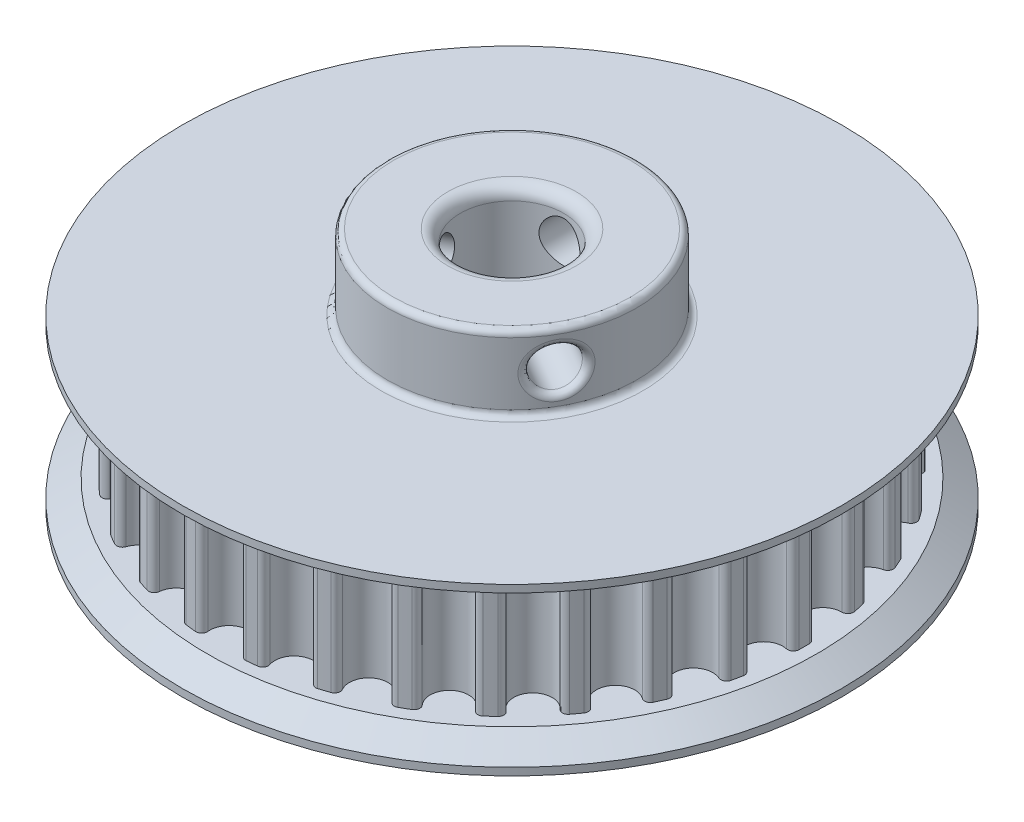
from build123d import *
from OCP.BRepFilletAPI import BRepFilletAPI_MakeChamfer

# Parameters (mm, degrees)
BOSS_EXTRU_1_DEPTH           = 9.3
R_P_TITION_CIRCULAIRE1_COUNT = 30
ESQUISSE2_R                  = 26.4290252
BOSS_EXTRU_2_DEPTH           = 2
CHANFREIN1_SIZE              = 2
CHANFREIN1_SIZE2             = 1.400415076
ESQUISSE4_R                  = 10
BOSS_EXTRU_3_DEPTH           = 6
ESQUISSE5_R                  = 1.65
ENL_V_MAT_EXTRU_2_DEPTH      = 42.185880421
R_P_TITION_CIRCULAIRE2_COUNT = 3
ENL_V_MAT_EXTRU_1_REACH      = 44.065
ESQUISSE3_R                  = 4.15
CONG_1_R                     = 1
CONG_2_R                     = 0.5


with BuildPart() as part:
    # Esquisse1 → Boss.-Extru.1 (new body)
    with BuildSketch(Plane(origin=(0, 0, 0), x_dir=(1, 0, 0), z_dir=(0, 1, 0))):
        with BuildLine():
            Line((0, 0), (-2.449, 23.300678548))
            ThreePointArc((-2.449, 23.300678548), (-2.23925905, 23.321769674), (-2.029336827, 23.340972856))
            ThreePointArc((-2.029336827, 23.340972856), (-1.662628217, 23.205334027), (-1.534260602, 22.83601729))
            ThreePointArc((-1.534260602, 22.83601729), (0, 21.1290252), (1.534260602, 22.83601729))
            ThreePointArc((1.534260602, 22.83601729), (1.662628217, 23.205334027), (2.029336827, 23.340972856))
            ThreePointArc((2.029336827, 23.340972856), (2.23925905, 23.321769674), (2.449, 23.300678548))
            Line((2.449, 23.300678548), (0, 0))
        make_face()
    boss_extru_1 = extrude(amount=BOSS_EXTRU_1_DEPTH)

    # Répétition circulaire1: Boss.-Extru.1 ×30 about axis
    r_p_tition_circulaire1_axis = Axis((0, 9.3, 0), (0, -1, 0))
    for i in range(1, R_P_TITION_CIRCULAIRE1_COUNT):
        add(boss_extru_1.rotate(r_p_tition_circulaire1_axis, i * 360 / R_P_TITION_CIRCULAIRE1_COUNT))

    # Esquisse2 → Boss.-Extru.2 (add)
    with BuildSketch(Plane(origin=(0, 9.3, 0), x_dir=(1, 0, 0), z_dir=(0, 1, 0))):
        Circle(ESQUISSE2_R)
    boss_extru_2 = extrude(amount=BOSS_EXTRU_2_DEPTH)

    # Symétrie1: Boss.-Extru.2 across plane
    add(boss_extru_2.mirror(Plane(origin=(0, 4.65, 0), x_dir=(0, 0, 1), z_dir=(0, -1, 0))))

    # Chanfrein1: one chamfer whose edges measure the first distance from different faces: ONE call of the kernel's chamfer builder (chamfer() names one face for all edges)
    chanfrein1_edges_1 = [part.edges().sort_by_distance(p)[0] for p in [
        (-26.4290252, 9.3, 0),
    ]]
    chanfrein1_side_1 = [part.faces().sort_by_distance(p)[0] for p in [
        (-25.681499482, 9.3, 0),
    ]]
    chanfrein1_edges_2 = [part.edges().sort_by_distance(p)[0] for p in [
        (-26.4290252, 0, 0),
    ]]
    chanfrein1_side_2 = [part.faces().sort_by_distance(p)[0] for p in [
        (-25.681499482, 0, 0),
    ]]
    chanfrein1 = BRepFilletAPI_MakeChamfer(part.part.solid().wrapped)
    for e in chanfrein1_edges_1:
        chanfrein1.Add(CHANFREIN1_SIZE, CHANFREIN1_SIZE2, e.wrapped, chanfrein1_side_1[0].wrapped)  # the first distance lies on this face
    for e in chanfrein1_edges_2:
        chanfrein1.Add(CHANFREIN1_SIZE, CHANFREIN1_SIZE2, e.wrapped, chanfrein1_side_2[0].wrapped)  # the first distance lies on this face
    add(Compound.cast(chanfrein1.Shape()), mode=Mode.REPLACE)

    # Esquisse4 → Boss.-Extru.3 (add)
    with BuildSketch(Plane(origin=(0, 11.3, 0), x_dir=(1, 0, 0), z_dir=(0, 1, 0))):
        Circle(ESQUISSE4_R)
    extrude(amount=BOSS_EXTRU_3_DEPTH)

    # Esquisse5 → Enlèv. mat.-Extru.2 (cut, through all)
    with BuildSketch(Plane.XY):
        with Locations((0, 14.3)):
            Circle(ESQUISSE5_R)
    enl_v_mat_extru_2 = extrude(amount=-ENL_V_MAT_EXTRU_2_DEPTH, mode=Mode.SUBTRACT)

    # Répétition circulaire2: Enlèv. mat.-Extru.2 ×3 about axis
    r_p_tition_circulaire2_axis = Axis((0, 17.3, 0), (0, -1, 0))
    for i in range(1, R_P_TITION_CIRCULAIRE2_COUNT):
        add(enl_v_mat_extru_2.rotate(r_p_tition_circulaire2_axis, i * 360 / R_P_TITION_CIRCULAIRE2_COUNT), mode=Mode.SUBTRACT)

    # Esquisse3 → Enlèv. mat.-Extru.1 (cut, up to next)
    with BuildSketch(Plane(origin=(0, 17.3, 0), x_dir=(1, 0, 0), z_dir=(0, 1, 0)), mode=Mode.PRIVATE) as enl_v_mat_extru_1_sk1:
        Circle(ESQUISSE3_R)
    enl_v_mat_extru_1_tool1 = extrude(enl_v_mat_extru_1_sk1.sketch, amount=-ENL_V_MAT_EXTRU_1_REACH, mode=Mode.PRIVATE) & part.part
    add(enl_v_mat_extru_1_tool1.solids().sort_by_distance((0, 17.3, 0))[0], mode=Mode.SUBTRACT)

    # Congé1
    cong_1_edges = [part.edges().sort_by_distance(p)[0] for p in [
        (-4.15, -2, 0),
        (-4.15, 17.3, 0),
    ]]
    fillet(cong_1_edges, radius=CONG_1_R)

    # Congé2
    cong_2_edges = [part.edges().sort_by_distance(p)[0] for p in [
        (-10, 11.3, 0),
        (-10, 17.3, 0),
        (-1.650000023, 14.300000005, -9.862935666),
        (-7.716552831, 14.300000005, 6.360409769),
        (9.366552854, 14.300000005, 3.502525897),
    ]]
    fillet(cong_2_edges, radius=CONG_2_R)


solid = part.part
